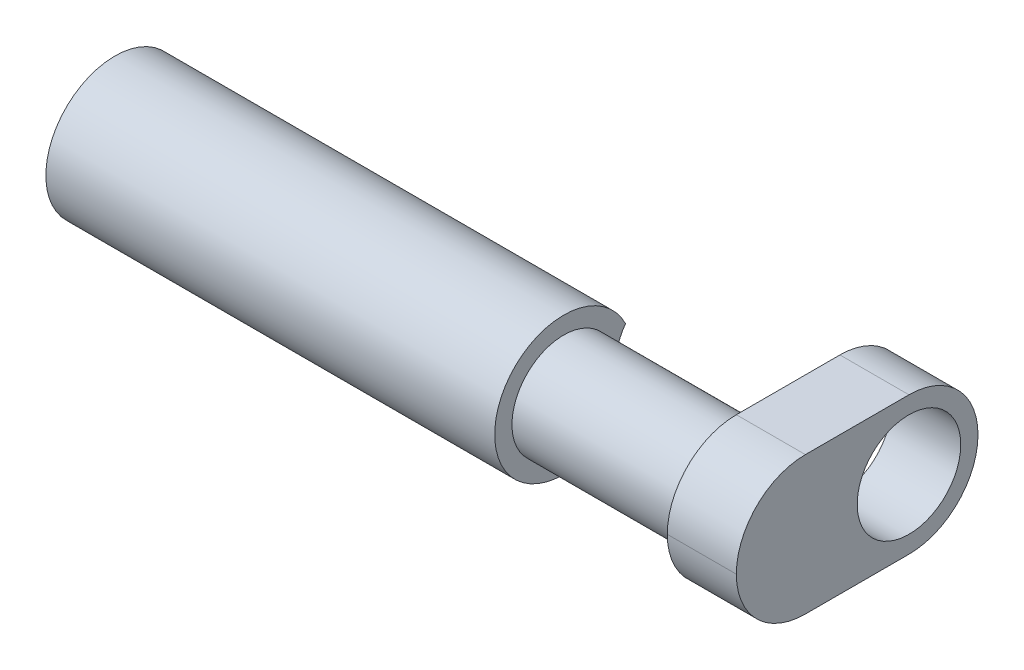
from build123d import *

# Parameters (mm, degrees)
SKETCH2_R           = 2
BOSS_EXTRUDE1_DEPTH = 13
SKETCH3_R           = 1.5
BOSS_EXTRUDE2_DEPTH = 7
SKETCH4_W           = 3.988125856
SKETCH4_H           = 4
BOSS_EXTRUDE3_DEPTH = 2
SKETCH5_W           = 2
SKETCH5_H           = 4
BOSS_EXTRUDE4_DEPTH = 7
FILLET1_R           = 2
FILLET2_R           = 2
FILLET3_R           = 2
SKETCH6_R           = 1.5
CUT_EXTRUDE1_DEPTH  = 21.712315177


with BuildPart() as part:
    # Sketch2 → Boss-Extrude1 (new body)
    with BuildSketch(Plane(origin=(0, 0, 0), x_dir=(0, 0, -1), z_dir=(1, 0, 0))):
        Circle(SKETCH2_R)
    extrude(amount=BOSS_EXTRUDE1_DEPTH)

    # Sketch3 → Boss-Extrude2 (add)
    with BuildSketch(Plane(origin=(13, 0, 0), x_dir=(0, 0, -1), z_dir=(1, 0, 0))):
        Circle(SKETCH3_R)
    extrude(amount=BOSS_EXTRUDE2_DEPTH)

    # Sketch4 → Boss-Extrude3 (add)
    with BuildSketch(Plane(origin=(20, 0, 0), x_dir=(0, 0, -1), z_dir=(1, 0, 0))):
        with Locations((-0.005937072, 0)):
            Rectangle(SKETCH4_W, SKETCH4_H)
    extrude(amount=-BOSS_EXTRUDE3_DEPTH)

    # Sketch5 → Boss-Extrude4 (add)
    with BuildSketch(Plane.XY.offset(2)):
        with Locations((19, 0)):
            Rectangle(SKETCH5_W, SKETCH5_H)
    extrude(amount=-BOSS_EXTRUDE4_DEPTH)

    # Fillet1
    fillet1_edges = [part.edges().sort_by_distance(p)[0] for p in [
        (19, 2, 2),
    ]]
    fillet(fillet1_edges, radius=FILLET1_R)

    # Fillet2
    fillet2_edges = [part.edges().sort_by_distance(p)[0] for p in [
        (19, -2, 2),
    ]]
    fillet(fillet2_edges, radius=FILLET2_R - 0.0001)  # a hair under: the kernel refuses the full size

    # Fillet3
    fillet3_edges = [part.edges().sort_by_distance(p)[0] for p in [
        (19, -2, -5),
        (19, 2, -5),
    ]]
    fillet(fillet3_edges, radius=FILLET3_R - 0.0001)  # a hair under: the kernel refuses the full size

    # Sketch6 → Cut-Extrude1 (cut, through all)
    with BuildSketch(Plane(origin=(20, 0, 0), x_dir=(0, 0, -1), z_dir=(1, 0, 0))):
        with Locations((3, 0)):
            Circle(SKETCH6_R)
    extrude(amount=-CUT_EXTRUDE1_DEPTH, mode=Mode.SUBTRACT)


solid = part.part
